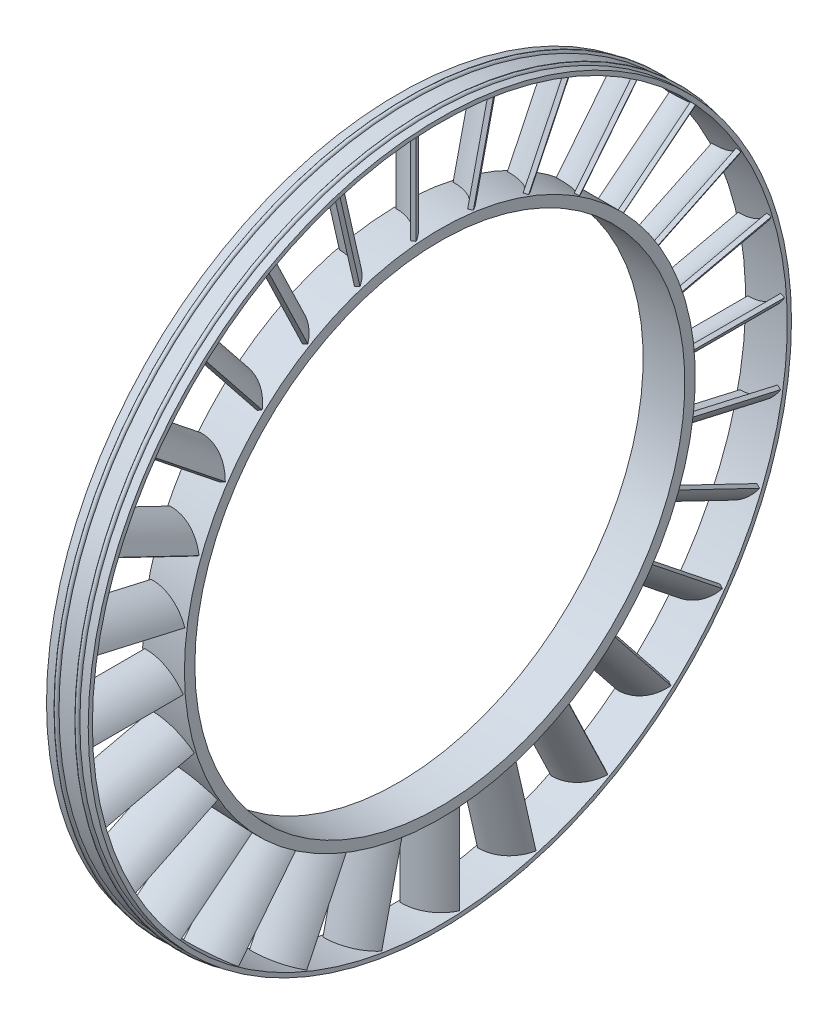
from build123d import *

# Parameters (mm, degrees)
SKETCH1_W                = 20
SKETCH1_H                = 5
EXTRUDE_THIN1_REACH      = 242.116
EXTRUDE_THIN1_END_RADIUS = 166.64
CIRPATTERN1_COUNT        = 28
SKETCH3_R                = 117.5
CUT_EXTRUDE1_DEPTH       = 30


with BuildPart() as part:
    # Sketch1 → Revolve1 (revolve)
    with BuildSketch(Plane.XY):
        with Locations((0, 120)):
            Rectangle(SKETCH1_W, SKETCH1_H)
        with BuildLine():
            Line((-10, 166.64), (10, 166.64))
            Line((10, 166.64), (10, 168.64))
            Line((10, 168.64), (6, 168.64))
            ThreePointArc((6, 168.64), (5, 169.64), (4, 168.64))
            Line((4, 168.64), (-4, 168.64))
            ThreePointArc((-4, 168.64), (-5, 169.64), (-6, 168.64))
            Line((-6, 168.64), (-10, 168.64))
            Line((-10, 168.64), (-10, 166.64))
        make_face()
    revolve(axis=Axis((-31.896551724, 0, 0), (1, 0, 0)))

    # Extrude-Thin1: up to this cylinder (the profile starts inside it)
    extrude_thin1_end = Plane(origin=(0.497108, 0, 0), z_dir=(-1, 0, 0)) * Cylinder(EXTRUDE_THIN1_END_RADIUS, 818.512, mode=Mode.PRIVATE)
    # Sketch2 → Extrude-Thin1 (add, up to the surface)
    with BuildSketch(Plane(origin=(0, 0, 0), x_dir=(1, 0, 0), z_dir=(0, 1, 0)), mode=Mode.PRIVATE) as extrude_thin1_sk1:
        with BuildLine():
            ThreePointArc((-9, 0), (1.452684065, -2.665054627), (9, -10.372138543))
            Line((9, -10.372138543), (7.246574942, -11.334167943))
            ThreePointArc((7.246574942, -11.334167943), (0.454140501, -4.397945493), (-8.95306755, -1.99944926))
            Line((-8.95306755, -1.99944926), (-9, 0))
        make_face()
    extrude_thin1_tool1 = extrude(extrude_thin1_sk1.sketch, amount=EXTRUDE_THIN1_REACH, mode=Mode.PRIVATE) & extrude_thin1_end
    extrude_thin1 = extrude_thin1_tool1.solids().sort_by_distance((0.497108, 0, 4.323379))[0]
    add(extrude_thin1)

    # CirPattern1: Extrude-Thin1 ×28 about axis
    cirpattern1_axis = Axis((-31.896551724, 0, 0), (-1, 0, 0))
    for i in range(1, CIRPATTERN1_COUNT):
        add(extrude_thin1.rotate(cirpattern1_axis, i * 360 / CIRPATTERN1_COUNT))

    # Sketch3 → Cut-Extrude1 (cut, symmetric)
    with BuildSketch(Plane(origin=(0, 0, 0), x_dir=(0, 0, -1), z_dir=(1, 0, 0))):
        Circle(SKETCH3_R)
    extrude(amount=CUT_EXTRUDE1_DEPTH, both=True, mode=Mode.SUBTRACT)


solid = part.part
